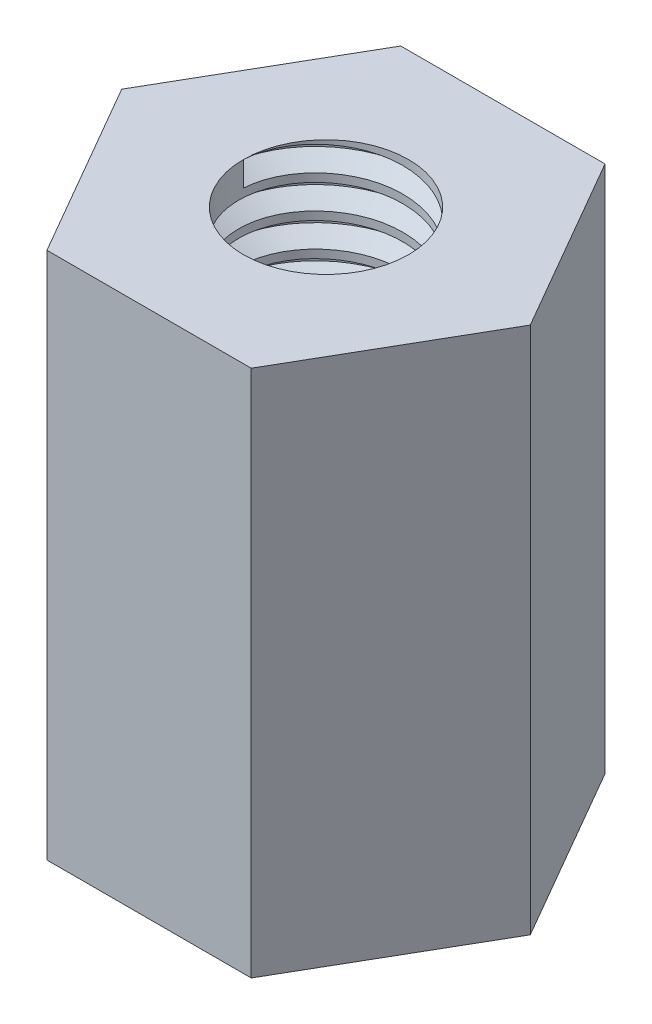
from build123d import *

# Parameters (mm, degrees)
SKETCH1_R           = 1.25
BOSS_EXTRUDE1_DEPTH = 8
THREAD1_PITCH       = 0.5


with BuildPart() as part:
    # Sketch1 → Boss-Extrude1 (new body)
    with BuildSketch(Plane(origin=(0, 0, 0), x_dir=(1, 0, 0), z_dir=(0, 1, 0))):
        Polygon((3.094597443, 0), (1.547298721, 2.68), (-1.547298721, 2.68), (-3.094597443, 0), (-1.547298721, -2.68), (1.547298721, -2.68), align=None)
        with Locations(Location((0, 0, 0), (0, 0, 270))):
            Circle(SKETCH1_R, mode=Mode.SUBTRACT)
    extrude(amount=BOSS_EXTRUDE1_DEPTH)

    # Thread1: the profile of Thread Profile1 profile screwed along a right-hand helix of 16 turns, 6 arcs to a turn; built about Z, then put on its axis
    thread1_z = Axis((0, 0, 0), (0, 0, 1))
    thread1_corners = [(1.2497, 0, -0.000173205), (1.520632938, 0, 0.156249999), (1.520632937, 0, 0.218749999), (1.2497, 0, 0.375173204)]
    with BuildLine(mode=Mode.PRIVATE) as thread1_profile:
        Line(thread1_corners[0], thread1_corners[1])
        Line(thread1_corners[1], thread1_corners[2])
        Line(thread1_corners[2], thread1_corners[3])
        Line(thread1_corners[3], thread1_corners[0])
    thread1_cap = Face(thread1_profile.wire())
    thread1_turn_angles = [0, 30, 60, 90, 120, 150, 180, 210, 240, 270, 300, 330, 360]
    thread1_turn_weights = [1, 0.8660254037844387, 1, 0.8660254037844387, 1, 0.8660254037844387, 1, 0.8660254037844387, 1, 0.8660254037844387, 1, 0.8660254037844387, 1]
    thread1_turn_rails = [Edge.make_bspline([Vector(p[0], p[1], 0).rotate(thread1_z, thread1_turn_angles[k]) / thread1_turn_weights[k] + Vector(0, 0, p[2] + THREAD1_PITCH * thread1_turn_angles[k] / 360) for k in range(13)], [0, 0, 0, 1, 1, 2, 2, 3, 3, 4, 4, 5, 5, 6, 6, 6], 2, thread1_turn_weights) for p in thread1_corners]
    thread1_turn_sides = [Face.make_surface_from_curves(thread1_turn_rails[p[0]], thread1_turn_rails[p[1]]) for p in [(0, 1), (1, 2), (2, 3), (3, 0)]]
    thread1 = Plane(origin=(0, 8, 0), x_dir=(-1, 0, 0), z_dir=(0, -1, 0)) * Solid(Shell([*[p.moved(Location((0, 0, THREAD1_PITCH * i))) for i in range(16) for p in thread1_turn_sides], thread1_cap, thread1_cap.rotate(thread1_z, 5760).moved(Location((0, 0, THREAD1_PITCH * 5760 / 360)))]))
    add(thread1, mode=Mode.SUBTRACT)


solid = part.part
